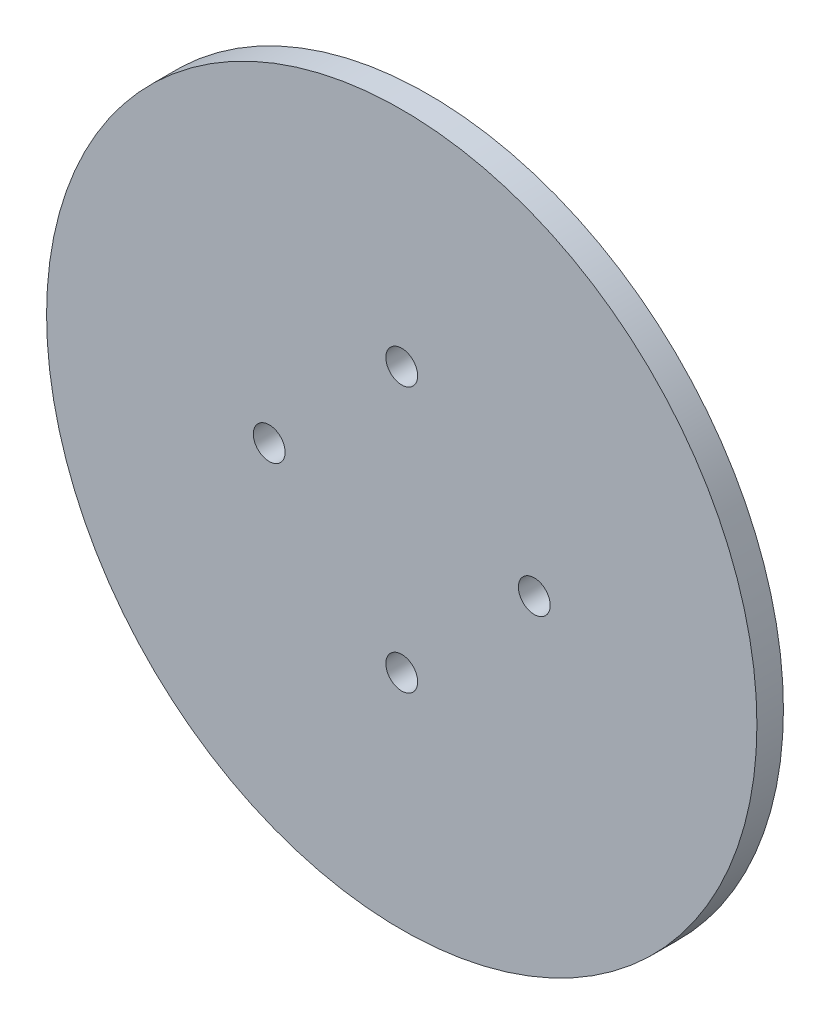
from build123d import *

# Parameters (mm, degrees)
SZKIC1_R                    = 67
SZKIC1_R_2                  = 3
DODANIE_WYCI_GNI_CIE1_DEPTH = 5


with BuildPart() as part:
    # Szkic1 → Dodanie-wyciągnięcie1 (new body)
    with BuildSketch(Plane.XY):
        Circle(SZKIC1_R)
        with Locations((0, 25)):
            Circle(SZKIC1_R_2, mode=Mode.SUBTRACT)
        with Locations((25, 0)):
            Circle(SZKIC1_R_2, mode=Mode.SUBTRACT)
        with Locations((0, -25)):
            Circle(SZKIC1_R_2, mode=Mode.SUBTRACT)
        with Locations((-25, 0)):
            Circle(SZKIC1_R_2, mode=Mode.SUBTRACT)
    extrude(amount=DODANIE_WYCI_GNI_CIE1_DEPTH)


solid = part.part
